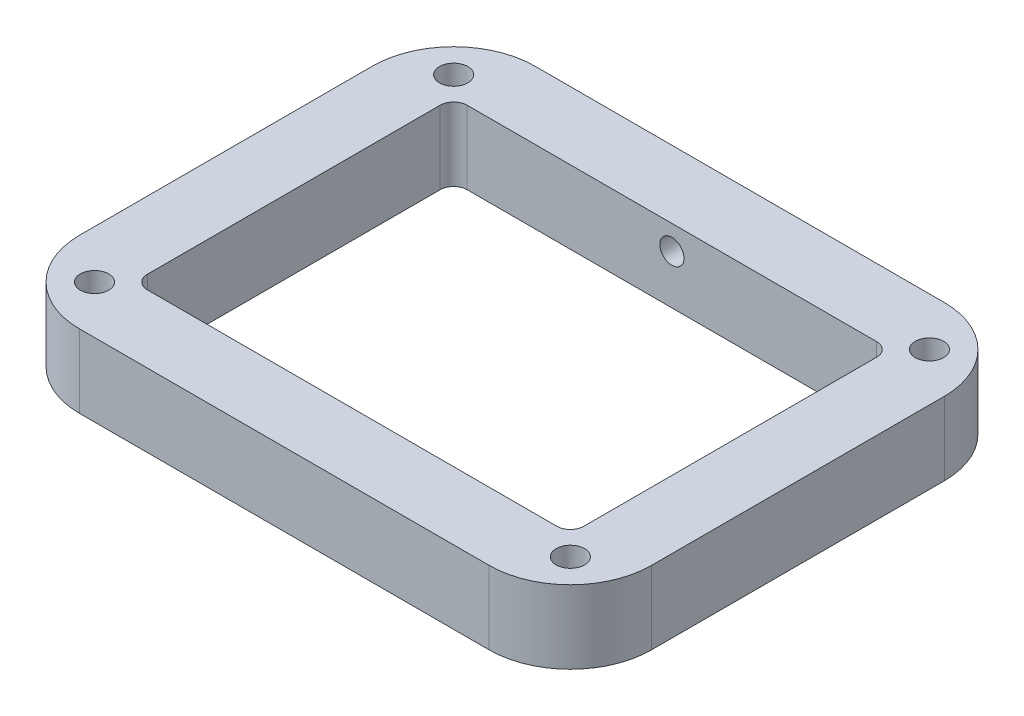
from build123d import *

# Parameters (mm, degrees)
BOSS_EXTRUDE1_DEPTH     = 16
SKETCH2_R               = 2.65
CUT_EXTRUDE1_DEPTH      = 20
CUT_EXTRUDE2_DEPTH      = 111.136478545
CUT_EXTRUDE2_DEPTH_BACK = 111.136478545
CUT_EXTRUDE3_DEPTH      = 111.136478545
CUT_EXTRUDE3_DEPTH_BACK = 111.136478545
SKETCH4_R               = 3.1
CUT_EXTRUDE4_DEPTH      = 111.136478545
CUT_EXTRUDE4_DEPTH_BACK = 6


with BuildPart() as part:
    # Sketch1 → Boss-Extrude1 (new body)
    with BuildSketch(Plane(origin=(0, 0, 0), x_dir=(1, 0, 0), z_dir=(0, 1, 0))):
        with BuildLine():
            Line((-44.75, 10.2375), (44.75, 10.2375))
            ThreePointArc((44.75, 10.2375), (57.301145366, 5.038645366), (62.5, -7.5125))
            Line((62.5, -7.5125), (62.5, -71.5125))
            ThreePointArc((62.5, -71.5125), (57.301145366, -84.063645366), (44.75, -89.2625))
            Line((44.75, -89.2625), (-44.75, -89.2625))
            ThreePointArc((-44.75, -89.2625), (-57.301145366, -84.063645366), (-62.5, -71.5125))
            Line((-62.5, -71.5125), (-62.5, -7.5125))
            ThreePointArc((-62.5, -7.5125), (-57.301145366, 5.038645366), (-44.75, 10.2375))
        make_face()
        with BuildLine():
            Line((-47.5, -7.5125), (-47.5, -71.5125))
            ThreePointArc((-47.5, -71.5125), (-46.694543648, -73.457043648), (-44.75, -74.2625))
            Line((-44.75, -74.2625), (44.75, -74.2625))
            ThreePointArc((44.75, -74.2625), (46.694543648, -73.457043648), (47.5, -71.5125))
            Line((47.5, -71.5125), (47.5, -7.5125))
            ThreePointArc((47.5, -7.5125), (46.694543648, -5.567956352), (44.75, -4.7625))
            Line((44.75, -4.7625), (-44.75, -4.7625))
            ThreePointArc((-44.75, -4.7625), (-46.694543648, -5.567956352), (-47.5, -7.5125))
        make_face(mode=Mode.SUBTRACT)
    extrude(amount=BOSS_EXTRUDE1_DEPTH)

    # Sketch2 → Cut-Extrude1 (cut)
    with BuildSketch(Plane.XY.offset(4.7625)):
        with Locations((0, 10.721875)):
            Circle(SKETCH2_R)
    extrude(amount=-CUT_EXTRUDE1_DEPTH, mode=Mode.SUBTRACT)

    # Sketch3 → Cut-Extrude2 (cut, two sides: drawn at the far end of the back side and taken through both)
    with BuildSketch(Plane(origin=(0, 0, 0), x_dir=(1, 0, 0), z_dir=(0, 1, 0)).offset(-CUT_EXTRUDE2_DEPTH_BACK)):
        with BuildLine():
            Line((-47.7, -7.5125), (-47.7, -71.5125))
            ThreePointArc((-47.7, -71.5125), (-46.835965004, -73.598465004), (-44.75, -74.4625))
            Line((-44.75, -74.4625), (44.75, -74.4625))
            ThreePointArc((44.75, -74.4625), (46.835965004, -73.598465004), (47.7, -71.5125))
            Line((47.7, -71.5125), (47.7, -7.5125))
            ThreePointArc((47.7, -7.5125), (46.835965004, -5.426534996), (44.75, -4.5625))
            Line((44.75, -4.5625), (-44.75, -4.5625))
            ThreePointArc((-44.75, -4.5625), (-46.835965004, -5.426534996), (-47.7, -7.5125))
        make_face()
        with BuildLine():
            Line((-44.75, -74.2625), (44.75, -74.2625))
            ThreePointArc((44.75, -74.2625), (46.694543648, -73.457043648), (47.5, -71.5125))
            Line((47.5, -71.5125), (47.5, -7.5125))
            ThreePointArc((47.5, -7.5125), (46.694543648, -5.567956352), (44.75, -4.7625))
            Line((44.75, -4.7625), (-44.75, -4.7625))
            ThreePointArc((-44.75, -4.7625), (-46.694543648, -5.567956352), (-47.5, -7.5125))
            Line((-47.5, -7.5125), (-47.5, -71.5125))
            ThreePointArc((-47.5, -71.5125), (-46.694543648, -73.457043648), (-44.75, -74.2625))
        make_face(mode=Mode.SUBTRACT)
    extrude(amount=CUT_EXTRUDE2_DEPTH + CUT_EXTRUDE2_DEPTH_BACK, mode=Mode.SUBTRACT)

    # Sketch4 → Cut-Extrude3 (cut, two sides: drawn at the far end of the back side and taken through both)
    with BuildSketch(Plane.XZ.offset(-CUT_EXTRUDE3_DEPTH_BACK)):
        with Locations((-51.997844507, 78.760344507)):
            Circle(SKETCH4_R)
        with Locations((51.997844507, 78.760344507)):
            Circle(SKETCH4_R)
        with Locations((51.997844507, 0.264655493)):
            Circle(SKETCH4_R)
        with Locations((-51.997844507, 0.264655493)):
            Circle(SKETCH4_R)
    extrude(amount=CUT_EXTRUDE3_DEPTH + CUT_EXTRUDE3_DEPTH_BACK, mode=Mode.SUBTRACT)

    # Sketch5 → Cut-Extrude4 (cut, two sides: drawn at the far end of the back side and taken through both)
    with BuildSketch(Plane.XZ.offset(-CUT_EXTRUDE4_DEPTH_BACK)):
        Polygon((-46.108871761, 78.760344507), (-49.053358134, 83.860344507), (-54.94233088, 83.860344507), (-57.886817253, 78.760344507), (-54.94233088, 73.660344507), (-49.053358134, 73.660344507), align=None)
        Polygon((57.886817253, 78.760344507), (54.94233088, 83.860344507), (49.053358134, 83.860344507), (46.108871761, 78.760344507), (49.053358134, 73.660344507), (54.94233088, 73.660344507), align=None)
        Polygon((57.886817253, 0.264655493), (54.94233088, 5.364655493), (49.053358134, 5.364655493), (46.108871761, 0.264655493), (49.053358134, -4.835344507), (54.94233088, -4.835344507), align=None)
        Polygon((-46.108871761, 0.264655493), (-49.053358134, 5.364655493), (-54.94233088, 5.364655493), (-57.886817253, 0.264655493), (-54.94233088, -4.835344507), (-49.053358134, -4.835344507), align=None)
    extrude(amount=CUT_EXTRUDE4_DEPTH + CUT_EXTRUDE4_DEPTH_BACK, mode=Mode.SUBTRACT)


solid = part.part
